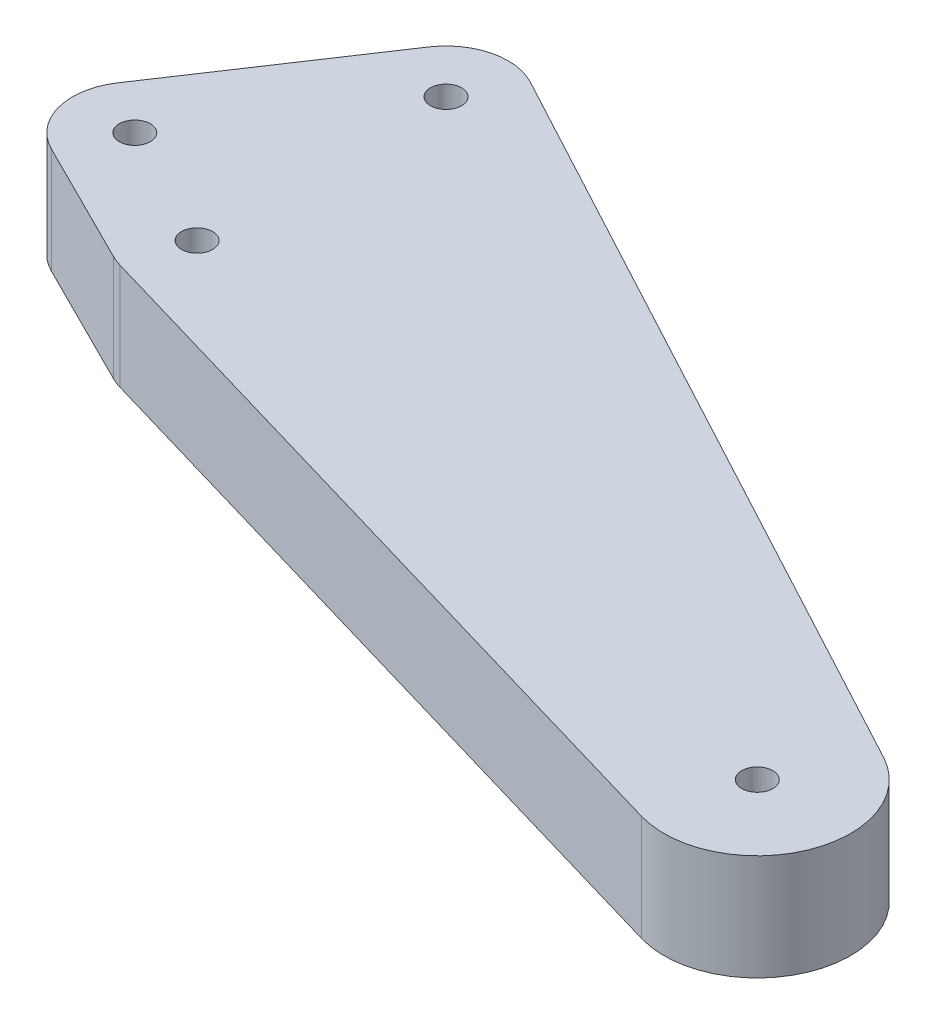
from build123d import *

# Parameters (mm, degrees)
BOSS_EXTRUDE1_DEPTH = 17
SKETCH2_R           = 2.5
CUT_EXTRUDE1_DEPTH  = 145.962064003


with BuildPart() as part:
    # Sketch1 → Boss-Extrude1 (new body)
    with BuildSketch(Plane(origin=(0, 0, 0), x_dir=(1, 0, 0), z_dir=(0, 1, 0))):
        with BuildLine():
            Line((4.724564955, 48.813539923), (127.086847433, -16.779690115))
            ThreePointArc((127.086847433, -16.779690115), (133.880787219, -35.685397627), (115.776703796, -44.393184817))
            Line((115.776703796, -44.393184817), (-2.815530803, -9.595456545))
            ThreePointArc((-2.815530803, -9.595456545), (-3.658351002, -9.306796868), (-4.472135955, -8.94427191))
            Line((-4.472135955, -8.94427191), (-24.472135955, 1.05572809))
            ThreePointArc((-24.472135955, 1.05572809), (-29.664996488, 7.433320648), (-28.320502943, 15.547001962))
            Line((-28.320502943, 15.547001962), (-8.320502943, 45.547001962))
            ThreePointArc((-8.320502943, 45.547001962), (-2.429045094, 49.700502045), (4.724564955, 48.813539923))
        make_face()
    extrude(amount=BOSS_EXTRUDE1_DEPTH)

    # Sketch2 → Cut-Extrude1 (cut, through all)
    with BuildSketch(Plane(origin=(0, 17, 0), x_dir=(1, 0, 0), z_dir=(0, 1, 0))):
        with Locations((0, 40)):
            Circle(SKETCH2_R)
        Circle(SKETCH2_R)
        with Locations((120, -30)):
            Circle(SKETCH2_R)
        with Locations((-20, 10)):
            Circle(SKETCH2_R)
    extrude(amount=-CUT_EXTRUDE1_DEPTH, mode=Mode.SUBTRACT)


solid = part.part
